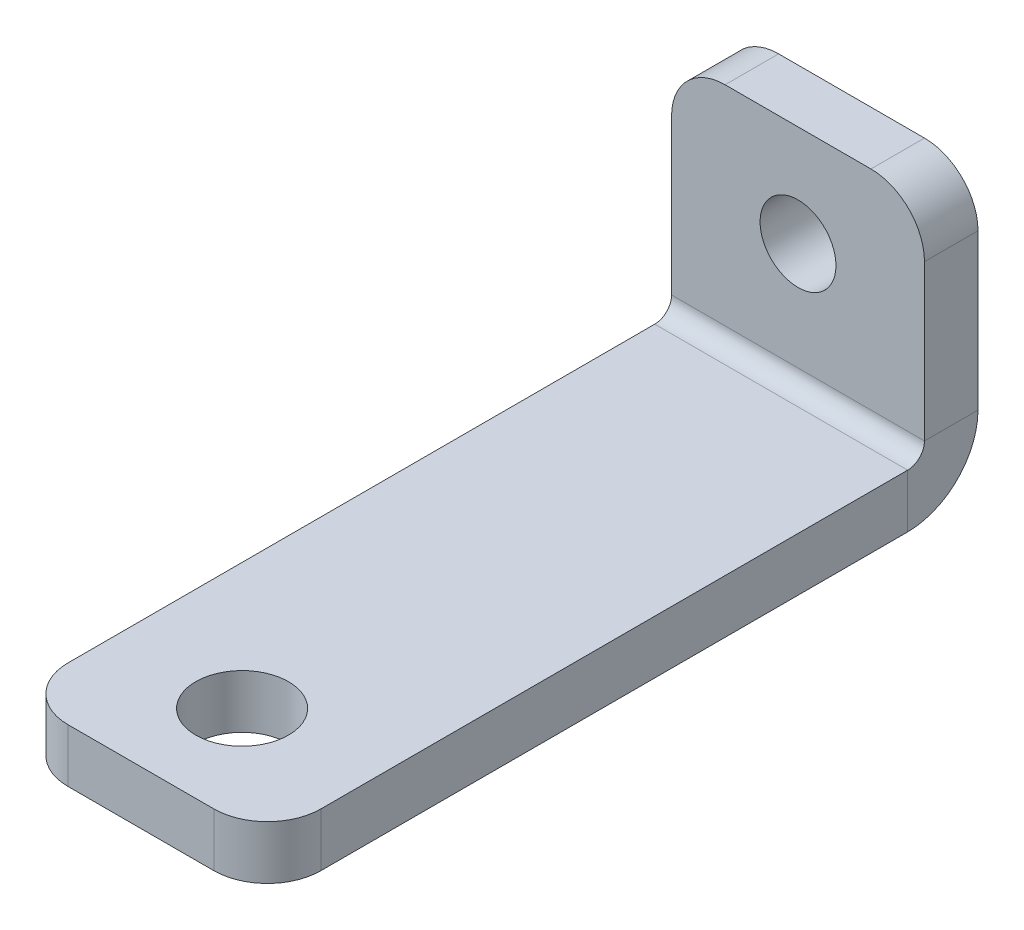
from build123d import *

# Parameters (mm, degrees)
SKETCH1_W                    = 15
SKETCH1_H                    = 42.15
BASE_FLANGE1_DEPTH           = 3.175
EDGE_FLANGE1_STRIP_W         = 14.7
EDGE_FLANGE1_STRIP_H         = 3.175
EDGE_FLANGE1_STRIP_CUT_DEPTH = 15
EDGE_FLANGE1_DEPTH           = 15
M5_CLEARANCE_HOLE1_D         = 5.5
M4_CLEARANCE_HOLE1_D         = 4.5
FILLET1_R                    = 3.175


# Sheet-metal steps are written as plain solids
with BuildPart() as part:
    # Sketch1 → Base-Flange1 (new body)
    with BuildSketch(Plane(origin=(0, 0, 0), x_dir=(1, 0, 0), z_dir=(0, 1, 0))):
        Rectangle(SKETCH1_W, SKETCH1_H)
    extrude(amount=BASE_FLANGE1_DEPTH)

    # Edge-Flange1 strip (across the edge) → Edge-Flange1 strip cut (cut)
    with BuildSketch(Plane(origin=(7.5, 3.175, -21.075), x_dir=(0, 0, 1), z_dir=(-1, 0, 0))):
        with Locations((-3.175, -1.5875)):
            Rectangle(EDGE_FLANGE1_STRIP_W, EDGE_FLANGE1_STRIP_H)
    extrude(amount=EDGE_FLANGE1_STRIP_CUT_DEPTH, mode=Mode.SUBTRACT)

    # Edge-Flange1 section (across the edge) → Edge-Flange1 (add)
    with BuildSketch(Plane(origin=(7.5, 3.175, -21.075), x_dir=(0, 0, 1), z_dir=(-1, 0, 0))):
        with BuildLine():
            Line((0, 1), (0, 13.385))
            Line((0, 13.385), (3.175, 13.385))
            Line((3.175, 13.385), (3.175, 1))
            ThreePointArc((3.175, 1), (3.467893219, 0.292893219), (4.175, 0))
            Line((4.175, 0), (4.175, -3.175))
            ThreePointArc((4.175, -3.175), (1.222829189, -1.952170811), (0, 1))
        make_face()
    extrude(amount=EDGE_FLANGE1_DEPTH)

    # M5 Clearance Hole1 (through all)
    with Locations(Plane(origin=(0, 3.175, 0), x_dir=(1, 0, 0), z_dir=(0, 1, 0))):
        with Locations((0, -15.075)):
            Hole(M5_CLEARANCE_HOLE1_D / 2)

    # M4 Clearance Hole1 (through all)
    with Locations(Plane.XY.offset(-17.9)):
        with Locations((0, 10.56)):
            Hole(M4_CLEARANCE_HOLE1_D / 2)

    # Fillet1
    fillet1_edges = [part.edges().sort_by_distance(p)[0] for p in [
        (7.5, 16.56, -19.4875),
        (-7.5, 16.56, -19.4875),
        (7.5, 1.5875, 21.075),
        (-7.5, 1.5875, 21.075),
    ]]
    fillet(fillet1_edges, radius=FILLET1_R)


solid = part.part
